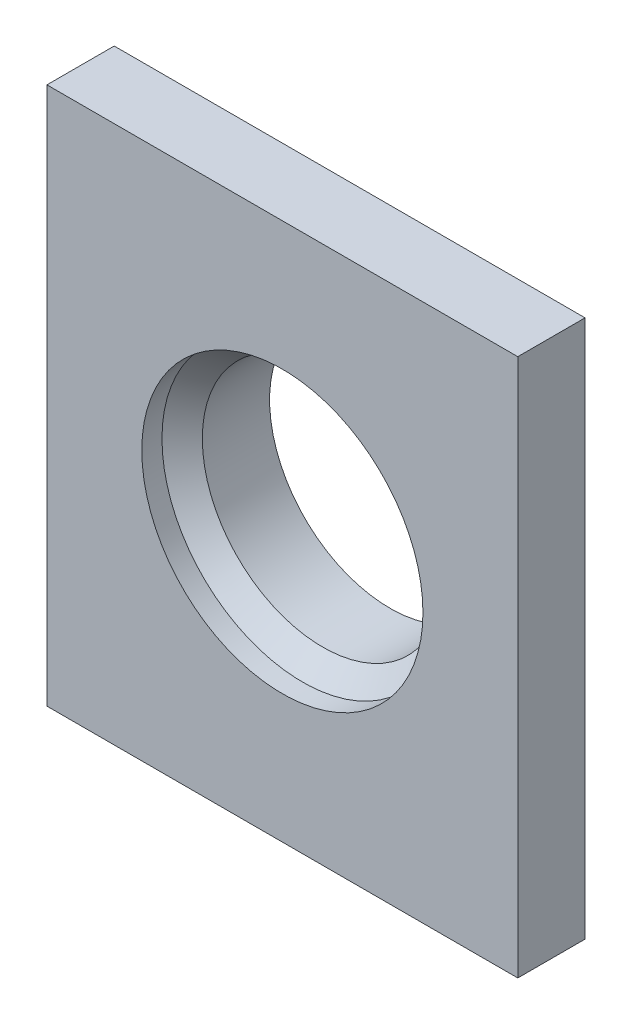
from build123d import *

# Parameters (mm, degrees)
SKETCH1_W           = 35
SKETCH1_H           = 40
BOSS_EXTRUDE1_DEPTH = 2.5
SKETCH5_R           = 10.95
BOSS_EXTRUDE2_DEPTH = 3
SKETCH2_R           = 8.95
CUT_EXTRUDE1_DEPTH  = 28.753378173
SKETCH6_R           = 10.45
CUT_EXTRUDE2_DEPTH  = 3
CHAMFER2_SIZE       = 1.5


with BuildPart() as part:
    # Sketch1 → Boss-Extrude1 (new, symmetric)
    with BuildSketch(Plane.XY):
        Rectangle(SKETCH1_W, SKETCH1_H)
    extrude(amount=BOSS_EXTRUDE1_DEPTH, both=True)

    # Sketch5 → Boss-Extrude2 (add)
    with BuildSketch(Plane(origin=(0, 0, -2.5), x_dir=(-1, 0, 0), z_dir=(0, 0, -1))):
        Circle(SKETCH5_R)
    extrude(amount=BOSS_EXTRUDE2_DEPTH)

    # Sketch2 → Cut-Extrude1 (cut, through all)
    with BuildSketch(Plane.XY.offset(2.5)):
        Circle(SKETCH2_R)
    extrude(amount=-CUT_EXTRUDE1_DEPTH, mode=Mode.SUBTRACT)

    # Sketch6 → Cut-Extrude2 (cut)
    with BuildSketch(Plane.XY.offset(2.5)):
        Circle(SKETCH6_R)
    extrude(amount=-CUT_EXTRUDE2_DEPTH, mode=Mode.SUBTRACT)

    # Chamfer2
    chamfer2_edges = [part.edges().sort_by_distance(p)[0] for p in [
        (10.95, 0, -2.5),
        (-10.45, 0, -0.5),
    ]]
    chamfer(chamfer2_edges, length=CHAMFER2_SIZE - 0.0001)  # a hair under: the kernel refuses the full size


solid = part.part
